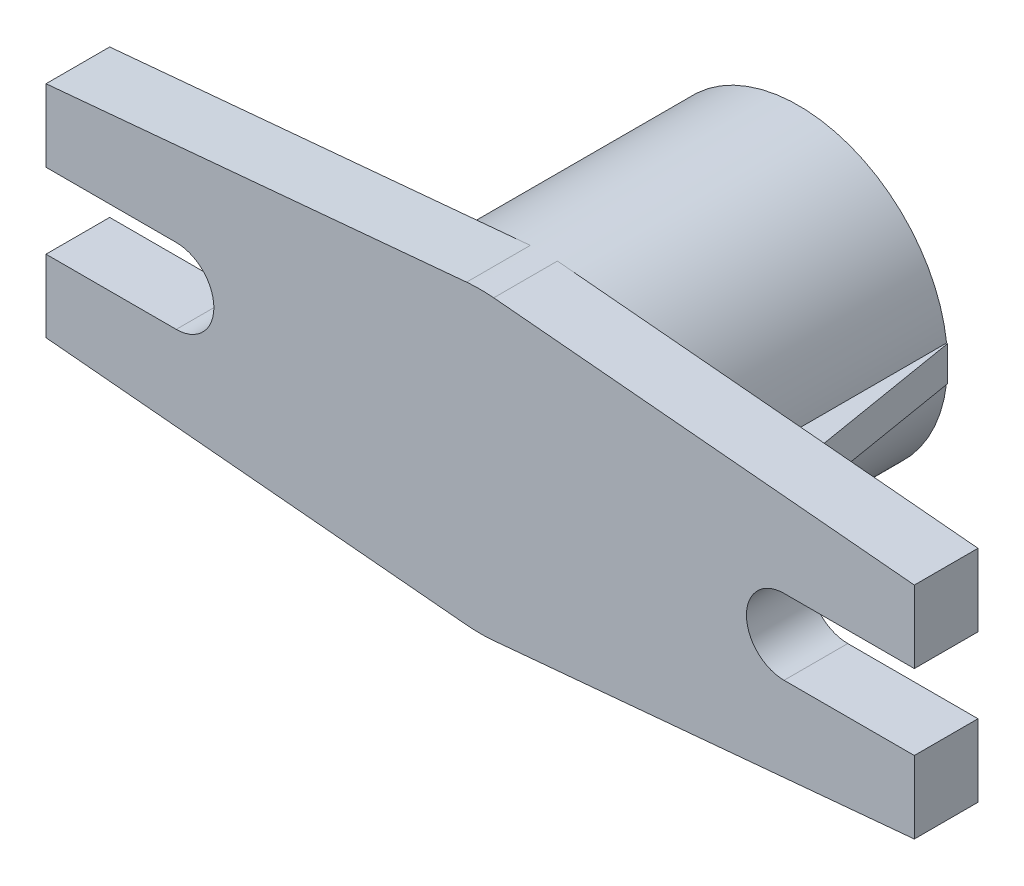
from build123d import *

# Parameters (mm, degrees)
SZKIC5_R                    = 51.5
DODANIE_WYCI_GNI_CIE5_DEPTH = 110
SZKIC6_R                    = 17
WYTNIJ_WYCI_GNI_CIE3_DEPTH  = 66
SZKIC8_R                    = 32
WYTNIJ_WYCI_GNI_CIE4_DEPTH  = 46
DODANIE_WYCI_GNI_CIE7_DEPTH = 22
EBRO3_START                 = -6
EBRO3_DEPTH                 = 12


# Read off the part's stored shape, not the designer's step: Żebro3
with BuildPart() as part:
    # Szkic5 → Dodanie-wyciągnięcie5 (new body)
    with BuildSketch(Plane.XY):
        Circle(SZKIC5_R)
    extrude(amount=DODANIE_WYCI_GNI_CIE5_DEPTH)

    # Szkic6 → Wytnij-wyciągnięcie3 (cut)
    with BuildSketch(Plane.XY):
        Circle(SZKIC6_R)
    extrude(amount=WYTNIJ_WYCI_GNI_CIE3_DEPTH, mode=Mode.SUBTRACT)

    # Szkic8 → Wytnij-wyciągnięcie4 (cut)
    with BuildSketch(Plane.XY.offset(110)):
        Circle(SZKIC8_R)
    extrude(amount=-WYTNIJ_WYCI_GNI_CIE4_DEPTH, mode=Mode.SUBTRACT)

    # Szkic9 → Dodanie-wyciągnięcie7 (add)
    with BuildSketch(Plane.XY.offset(110)):
        with BuildLine():
            Line((-150, 13), (-150, 38))
            Line((-150, 38), (-4.689194415, 51.286074677))
            Line((-4.689194415, 51.286074677), (4.689194415, 51.286074677))
            Line((4.689194415, 51.286074677), (150, 38))
            Line((150, 38), (150, 13))
            Line((150, 13), (105, 13))
            ThreePointArc((105, 13), (92, 0), (105, -13))
            Line((105, -13), (150, -13))
            Line((150, -13), (150, -38))
            Line((150, -38), (4.689194415, -51.286074677))
            Line((4.689194415, -51.286074677), (-4.689194415, -51.286074677))
            Line((-4.689194415, -51.286074677), (-150, -38))
            Line((-150, -38), (-150, -13))
            Line((-150, -13), (-105, -13))
            ThreePointArc((-105, -13), (-92, 0), (-105, 13))
            Line((-105, 13), (-150, 13))
        make_face()
    extrude(amount=-DODANIE_WYCI_GNI_CIE7_DEPTH)

    # Żebro3 outline → Żebro3 (add)
    with BuildSketch(Plane(origin=(0, 0, 0), x_dir=(1, 0, 0), z_dir=(0, 1, 0)).offset(EBRO3_START)):
        Polygon((66.136905435, -88), (51.5, 0), (51, 0), (51, -89), (66.303233906, -89), align=None)
    ebro3 = extrude(amount=EBRO3_DEPTH)

    # Lustro2: Żebro3 across plane
    add(ebro3.mirror(Plane(origin=(0, 0, 0), x_dir=(0, 0, 1), z_dir=(1, 0, 0))))


solid = part.part
